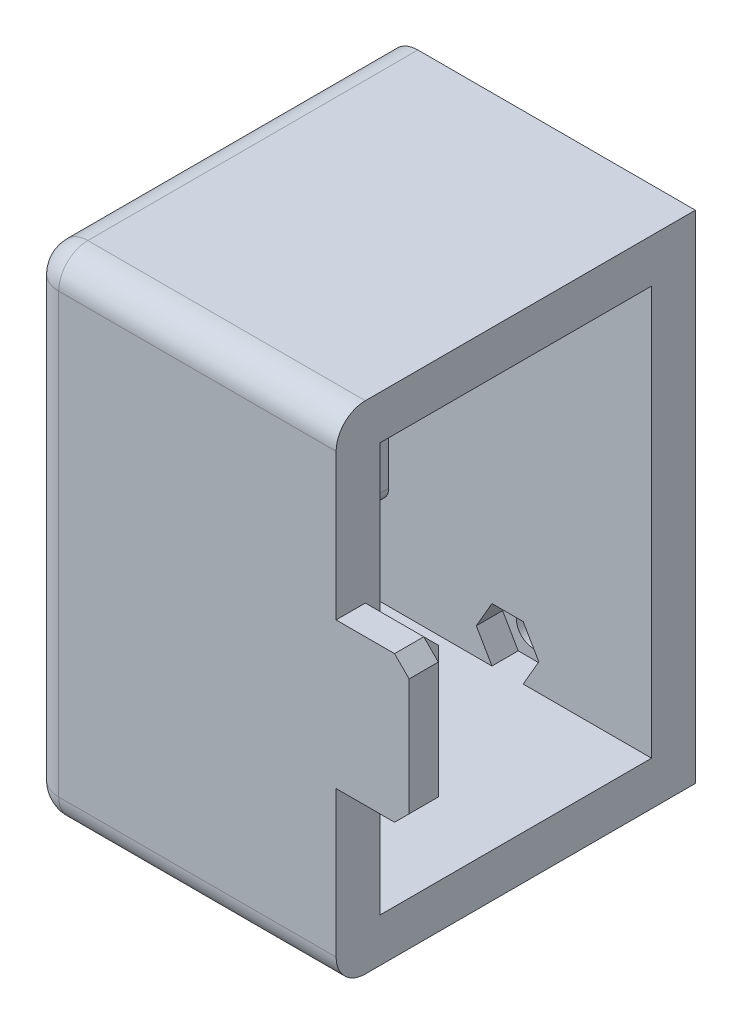
from build123d import *

# Parameters (mm, degrees)
BOSS_EXTRUDE1_DEPTH      = 21.59
BOSS_EXTRUDE1_DEPTH_BACK = 21.59
BOSS_EXTRUDE2_DEPTH      = 6.35
BOSS_EXTRUDE2_DEPTH_BACK = 6.35
SKETCH1_4_W              = 6.35
SKETCH1_4_H              = 3.81
SKETCH3_W                = 26.67
SKETCH3_H                = 31.242
BOSS_EXTRUDE3_DEPTH      = 3.81
SKETCH4_R                = 1.524
CUT_EXTRUDE1_DEPTH       = 2.286
SKETCH4_4_R              = 1.524
CUT_EXTRUDE3_DEPTH       = 39.616354359
SKETCH6_W                = 7.62
SKETCH6_H                = 7.62
CUT_EXTRUDE4_DEPTH       = 48.910486994
FILLET1_R                = 2.54
FILLET2_R                = 1.27
CHAMFER1_SIZE            = 1.27
CHAMFER2_SIZE            = 0.254


with BuildPart() as part:
    # Sketch1 → Boss-Extrude1 (new, two sides: drawn at the far end of the back side and taken through both)
    with BuildSketch(Plane(origin=(0, 0, 0), x_dir=(1, 0, 0), z_dir=(0, 1, 0)).offset(-BOSS_EXTRUDE1_DEPTH_BACK)):
        Polygon((-16.51, 31.242), (-16.51, 0), (10.16, 0), (10.16, 3.81), (-12.7, 3.81), (-12.7, 27.432), (10.16, 27.432), (10.16, 31.242), align=None)
    extrude(amount=BOSS_EXTRUDE1_DEPTH + BOSS_EXTRUDE1_DEPTH_BACK)

    # Sketch1<4> → Boss-Extrude2 (add, two sides: drawn at the far end of the back side and taken through both)
    with BuildSketch(Plane(origin=(0, 0, 0), x_dir=(1, 0, 0), z_dir=(0, 1, 0)).offset(-BOSS_EXTRUDE2_DEPTH_BACK)):
        with Locations((13.335, 1.905)):
            Rectangle(SKETCH1_4_W, SKETCH1_4_H)
    extrude(amount=BOSS_EXTRUDE2_DEPTH + BOSS_EXTRUDE2_DEPTH_BACK)

    # Sketch3 → Boss-Extrude3 (add)
    with BuildSketch(Plane(origin=(0, 21.59, 0), x_dir=(1, 0, 0), z_dir=(0, 1, 0))):
        with Locations((-3.175, 15.621)):
            Rectangle(SKETCH3_W, SKETCH3_H)
    boss_extrude3 = extrude(amount=-BOSS_EXTRUDE3_DEPTH)

    # Mirror1: Boss-Extrude3 across plane
    add(boss_extrude3.mirror(Plane.ZX))

    # Sketch4 → Cut-Extrude1 (cut)
    with BuildSketch(Plane.XY.offset(-27.432)):
        Polygon((0.3556, 15.426316158), (-1.0033, 17.78), (-3.7211, 17.78), (-5.08, 15.426316158), (-3.7211, 13.072632315), (-1.0033, 13.072632315), align=None)
        with Locations((-2.3622, 15.426316158)):
            Circle(SKETCH4_R, mode=Mode.SUBTRACT)
    cut_extrude1 = extrude(amount=-CUT_EXTRUDE1_DEPTH, mode=Mode.SUBTRACT)

    # Sketch4<4> → Cut-Extrude3 (cut, through all)
    with BuildSketch(Plane.XY.offset(-27.432)):
        with Locations((-2.3622, 15.426316158)):
            Circle(SKETCH4_4_R)
    cut_extrude3 = extrude(amount=-CUT_EXTRUDE3_DEPTH, mode=Mode.SUBTRACT)

    # Mirror2: Cut-Extrude1, Cut-Extrude3 across plane
    add(cut_extrude1.mirror(Plane.ZX), mode=Mode.SUBTRACT)
    add(cut_extrude3.mirror(Plane.ZX), mode=Mode.SUBTRACT)

    # Sketch6 → Cut-Extrude4 (cut, through all)
    with BuildSketch(Plane(origin=(-12.7, 0, 0), x_dir=(0, 0, -1), z_dir=(1, 0, 0))):
        with Locations((23.622, -13.97)):
            Rectangle(SKETCH6_W, SKETCH6_H)
    extrude(amount=-CUT_EXTRUDE4_DEPTH, mode=Mode.SUBTRACT)

    # Fillet1
    fillet1_edges = [part.edges().sort_by_distance(p)[0] for p in [
        (-16.51, 0, 0),
        (-16.51, 21.59, -15.621),
        (-3.175, 21.59, 0),
        (-16.51, -21.59, -15.621),
        (-3.175, -21.59, 0),
    ]]
    fillet(fillet1_edges, radius=FILLET1_R)

    # Fillet2
    fillet2_edges = [part.edges().sort_by_distance(p)[0] for p in [
        (-16.51, -13.97, -27.432),
        (-16.51, -17.78, -23.622),
        (-16.51, -13.97, -19.812),
        (-16.51, -10.16, -23.622),
        (-12.7, -10.16, -23.622),
        (-12.7, -13.97, -19.812),
    ]]
    fillet(fillet2_edges, radius=FILLET2_R - 0.0001)  # a hair under: the kernel refuses the full size

    # Chamfer1
    chamfer1_edges = [part.edges().sort_by_distance(p)[0] for p in [
        (13.335, -6.35, -3.81),
        (16.51, 0, -3.81),
        (16.51, -6.35, -1.905),
        (13.335, 6.35, -3.81),
        (16.51, 6.35, -1.905),
    ]]
    chamfer(chamfer1_edges, length=CHAMFER1_SIZE)

    # Chamfer2
    chamfer2_edges = [part.edges().sort_by_distance(p)[0] for p in [
        (-3.8862, 15.426316158, -31.242),
        (-3.8862, -15.426316158, -31.242),
    ]]
    chamfer(chamfer2_edges, length=CHAMFER2_SIZE)


solid = part.part
